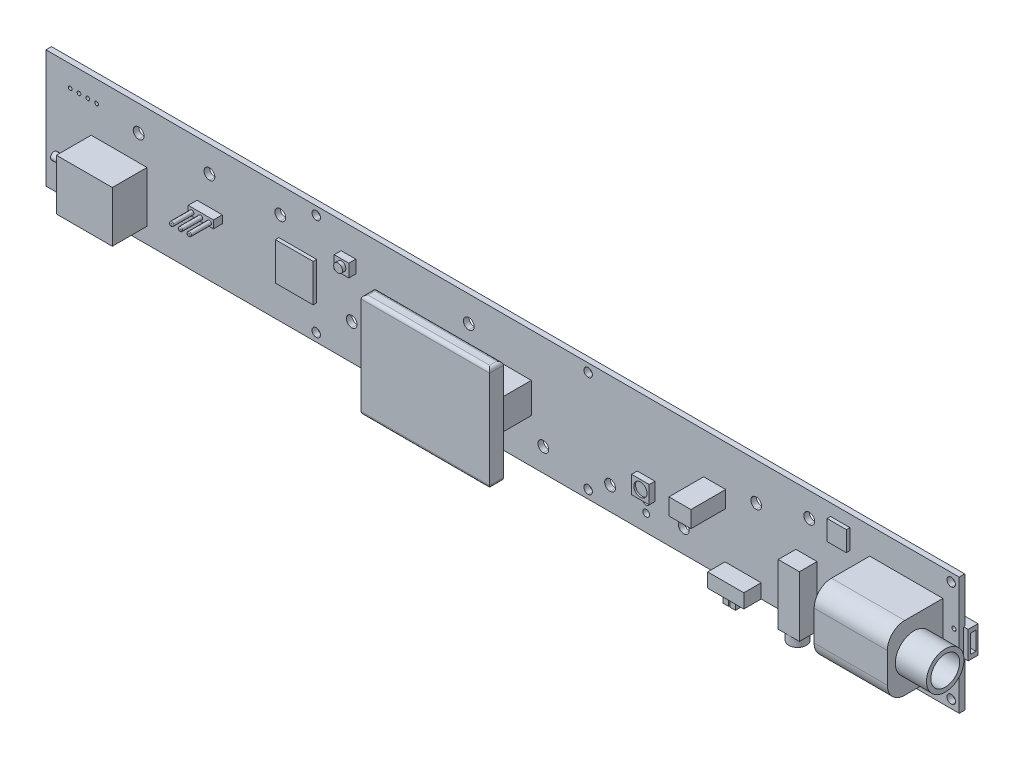
from build123d import *

# Parameters (mm, degrees)
MODEL_W                    = 263.024997078
MODEL_H                    = 33.99999939
BOSS_EXTRUDE1_DEPTH        = 1.6
SKETCH5_W                  = 16.091125075
SKETCH5_H                  = 14.669431921
BOSS_EXTRUDE5_DEPTH        = 10
SKETCH7_W                  = 10.892508314
SKETCH7_H                  = 10.848848998
BOSS_EXTRUDE7_DEPTH        = 1
SKETCH8_W                  = 4.210294841
SKETCH8_H                  = 3.712231415
BOSS_RESET_BUTTON_DEPTH    = 2
SKETCH9_R                  = 1.260457099
BOSS_EXTRUDE9_DEPTH        = 1
SKETCH10_W                 = 6.332555551
SKETCH10_H                 = 4.786515482
BOSS_EXTRUDE10_DEPTH       = 10
SKETCH11_W                 = 10.414
SKETCH11_H                 = 4.064
BOSS_EXTRUDE11_DEPTH       = 5
SKETCH12_W                 = 1.5748
SKETCH12_H                 = 1.27
BOSS_ON_OFF_BUTTON_DEPTH   = 2.54
SKETCH13_W                 = 6.096
SKETCH13_H                 = 17.399
BOSS_HEADPHONE_JACK1_DEPTH = 5.08
SKETCH14_R                 = 2.54
SKETCH14_R_2               = 1.778
BOSS_HEADPHONE_JACK2_DEPTH = 2.5
SKETCH15_W                 = 5.537872874
SKETCH15_H                 = 5.769764691
BOSS_EXTRUDE15_DEPTH       = 1
SKETCH16_W                 = 21.082
SKETCH16_H                 = 18.669
BOSS_EXTRUDE16_DEPTH       = 16
SKETCH17_R                 = 5.3975
SKETCH17_R_2               = 4.1475
BOSS_EXTRUDE17_DEPTH       = 9
BOSS_EXTRUDE18_DEPTH       = 2.54
BOSS_EXTRUDE18_DEPTH_BACK  = 0.3
SKETCH18_W                 = 5.842
SKETCH18_H                 = 7.874
SKETCH19_W                 = 1.594922006
SKETCH19_H                 = 5.279756627
CUT_EXTRUDE1_DEPTH         = 5
FILLET1_R                  = 5
SKETCH20_W                 = 6
SKETCH20_H                 = 6
BOSS_EXTRUDE19_DEPTH       = 3
SKETCH21_R                 = 2.5
BOSS_EXTRUDE20_DEPTH       = 11
SKETCH22_R                 = 1.039655937
BOSS_EXTRUDE21_DEPTH       = 3
SKETCH23_W                 = 5.08
SKETCH23_H                 = 5.08
BOSS_EXTRUDE22_DEPTH       = 1.651
BOSS_EXTRUDE23_DEPTH       = 1.905
BOSS_EXTRUDE24_DEPTH       = 1.5
BOSS_EXTRUDE24_DEPTH_BACK  = 10
SKETCH25_W                 = 11.813217451
SKETCH25_H                 = 1.460676172
BOSS_EXTRUDE25_DEPTH       = 0.5
SKETCH27_R                 = 1.905
CUT_EXTRUDE2_DEPTH         = 0.5
SKETCH28_W                 = 9.199246022
SKETCH28_H                 = 8.7957183
BOSS_EXTRUDE26_DEPTH       = 10
SKETCH29_W                 = 37
SKETCH29_H                 = 30
BOSS_EXTRUDE27_DEPTH       = 4
FILLET3_R                  = 1
SKETCH30_W                 = 8.02869844
SKETCH30_H                 = 8.621140661
BOSS_EXTRUDE28_DEPTH       = 5
SKETCH35_R                 = 0.6
BOSS_EXTRUDE29_DEPTH       = 8.54
SKETCH36_W                 = 7.262425727
SKETCH36_H                 = 2.23686425
BOSS_EXTRUDE30_DEPTH       = 2.54
FILLET5_R                  = 0.25
SKETCH38_R                 = 0.965
LED_PIN_HOLES_DEPTH        = 305.985327001
FILLET6_R                  = 0.75


with BuildPart() as part:
    # Model → Boss-Extrude1 (new body)
    with BuildSketch(Plane.XY):
        with Locations((166.116873048, 22.976248147)):
            Rectangle(MODEL_W, MODEL_H)
        with BuildLine():
            add(Edge.make_bspline(
                [(262.197098511, 34.516011578), (262.02174315, 34.516011578), (261.879598511, 34.658161062), (261.879598511, 34.833511578), (261.879598511, 35.008862094), (262.02174315, 35.151011578), (262.197098511, 35.151011578)],
                knots=[2, 2, 2, 2, 3, 3, 3, 4, 4, 4, 4], degree=3))
            add(Edge.make_bspline(
                [(262.197098511, 35.151011578), (262.372453871, 35.151011578), (262.514598511, 35.008862094), (262.514598511, 34.833511578), (262.514598511, 34.658161062), (262.372453871, 34.516011578), (262.197098511, 34.516011578)],
                knots=[0, 0, 0, 0, 1, 1, 1, 2, 2, 2, 2], degree=3))
        make_face(mode=Mode.SUBTRACT)
        with BuildLine():
            add(Edge.make_bspline(
                [(264.41164034, 33.408741202), (264.236284979, 33.408741202), (264.09414034, 33.550890686), (264.09414034, 33.726241202), (264.09414034, 33.901591717), (264.236284979, 34.043741202), (264.41164034, 34.043741202)],
                knots=[2, 2, 2, 2, 3, 3, 3, 4, 4, 4, 4], degree=3))
            add(Edge.make_bspline(
                [(264.41164034, 34.043741202), (264.5869957, 34.043741202), (264.729140339, 33.901591717), (264.729140339, 33.726241202), (264.729140339, 33.550890686), (264.5869957, 33.408741202), (264.41164034, 33.408741202)],
                knots=[0, 0, 0, 0, 1, 1, 1, 2, 2, 2, 2], degree=3))
        make_face(mode=Mode.SUBTRACT)
        with BuildLine():
            add(Edge.make_bspline(
                [(295.319366162, 36.366260398), (294.645591612, 36.366260398), (294.099371723, 36.912468713), (294.099371723, 37.586250799), (294.099371723, 38.260032885), (294.645591612, 38.806241201), (295.319366162, 38.806241201)],
                knots=[2, 2, 2, 2, 3, 3, 3, 4, 4, 4, 4], degree=3))
            add(Edge.make_bspline(
                [(295.319366162, 38.806241201), (295.993140711, 38.806241201), (296.539360601, 38.260032885), (296.539360601, 37.586250799), (296.539360601, 36.912468713), (295.993140711, 36.366260398), (295.319366162, 36.366260398)],
                knots=[0, 0, 0, 0, 1, 1, 1, 2, 2, 2, 2], degree=3))
        make_face(mode=Mode.SUBTRACT)
        with BuildLine():
            add(Edge.make_bspline(
                [(264.41164034, 32.301469749), (264.236284979, 32.301469749), (264.09414034, 32.443619772), (264.09414034, 32.618970287), (264.09414034, 32.794320803), (264.236284979, 32.936470287), (264.41164034, 32.936470287)],
                knots=[2, 2, 2, 2, 3, 3, 3, 4, 4, 4, 4], degree=3))
            add(Edge.make_bspline(
                [(264.41164034, 32.936470287), (264.5869957, 32.936470287), (264.729140339, 32.794320803), (264.729140339, 32.618970287), (264.729140339, 32.443619772), (264.5869957, 32.301469749), (264.41164034, 32.301469749)],
                knots=[0, 0, 0, 0, 1, 1, 1, 2, 2, 2, 2], degree=3))
        make_face(mode=Mode.SUBTRACT)
        with BuildLine():
            add(Edge.make_bspline(
                [(262.197098511, 33.408741202), (262.02174315, 33.408741202), (261.879598511, 33.550890686), (261.879598511, 33.726241202), (261.879598511, 33.901591717), (262.02174315, 34.043741202), (262.197098511, 34.043741202)],
                knots=[2, 2, 2, 2, 3, 3, 3, 4, 4, 4, 4], degree=3))
            add(Edge.make_bspline(
                [(262.197098511, 34.043741202), (262.372453871, 34.043741202), (262.514598511, 33.901591717), (262.514598511, 33.726241202), (262.514598511, 33.550890686), (262.372453871, 33.408741202), (262.197098511, 33.408741202)],
                knots=[0, 0, 0, 0, 1, 1, 1, 2, 2, 2, 2], degree=3))
        make_face(mode=Mode.SUBTRACT)
        with BuildLine():
            add(Edge.make_bspline(
                [(112.43937482, 36.376251175), (111.765591658, 36.376251175), (111.219380382, 36.92245949), (111.219380382, 37.596241576), (111.219380382, 38.270023662), (111.765591658, 38.816231978), (112.43937482, 38.816231978)],
                knots=[2, 2, 2, 2, 3, 3, 3, 4, 4, 4, 4], degree=3))
            add(Edge.make_bspline(
                [(112.43937482, 38.816231978), (113.113157983, 38.816231978), (113.659369259, 38.270023662), (113.659369259, 37.596241576), (113.659369259, 36.92245949), (113.113157983, 36.376251175), (112.43937482, 36.376251175)],
                knots=[0, 0, 0, 0, 1, 1, 1, 2, 2, 2, 2], degree=3))
        make_face(mode=Mode.SUBTRACT)
        with BuildLine():
            add(Edge.make_bspline(
                [(190.759374597, 7.156260405), (190.085600048, 7.156260405), (189.539380159, 7.702469528), (189.539380159, 8.376250537), (189.539380159, 9.050031546), (190.085600048, 9.59624067), (190.759374597, 9.59624067)],
                knots=[2, 2, 2, 2, 3, 3, 3, 4, 4, 4, 4], degree=3))
            add(Edge.make_bspline(
                [(190.759374597, 9.59624067), (191.433149147, 9.59624067), (191.979369036, 9.050031546), (191.979369036, 8.376250537), (191.979369036, 7.702469528), (191.433149147, 7.156260405), (190.759374597, 7.156260405)],
                knots=[0, 0, 0, 0, 1, 1, 1, 2, 2, 2, 2], degree=3))
        make_face(mode=Mode.SUBTRACT)
        with BuildLine():
            add(Edge.make_bspline(
                [(190.759374597, 36.366260398), (190.085600048, 36.366260398), (189.539380159, 36.912468713), (189.539380159, 37.586250799), (189.539380159, 38.260032885), (190.085600048, 38.806241201), (190.759374597, 38.806241201)],
                knots=[2, 2, 2, 2, 3, 3, 3, 4, 4, 4, 4], degree=3))
            add(Edge.make_bspline(
                [(190.759374597, 38.806241201), (191.433149147, 38.806241201), (191.979369036, 38.260032885), (191.979369036, 37.586250799), (191.979369036, 36.912468713), (191.433149147, 36.366260398), (190.759374597, 36.366260398)],
                knots=[0, 0, 0, 0, 1, 1, 1, 2, 2, 2, 2], degree=3))
        make_face(mode=Mode.SUBTRACT)
        with BuildLine():
            add(Edge.make_bspline(
                [(263.304369425, 33.408741202), (263.129014065, 33.408741202), (262.986869425, 33.550890686), (262.986869425, 33.726241202), (262.986869425, 33.901591717), (263.129014065, 34.043741202), (263.304369425, 34.043741202)],
                knots=[2, 2, 2, 2, 3, 3, 3, 4, 4, 4, 4], degree=3))
            add(Edge.make_bspline(
                [(263.304369425, 34.043741202), (263.479724785, 34.043741202), (263.621869425, 33.901591717), (263.621869425, 33.726241202), (263.621869425, 33.550890686), (263.479724785, 33.408741202), (263.304369425, 33.408741202)],
                knots=[0, 0, 0, 0, 1, 1, 1, 2, 2, 2, 2], degree=3))
        make_face(mode=Mode.SUBTRACT)
        with BuildLine():
            add(Edge.make_bspline(
                [(263.304369425, 34.516011578), (263.129014065, 34.516011578), (262.986869425, 34.658161062), (262.986869425, 34.833511578), (262.986869425, 35.008862094), (263.129014065, 35.151011578), (263.304369425, 35.151011578)],
                knots=[2, 2, 2, 2, 3, 3, 3, 4, 4, 4, 4], degree=3))
            add(Edge.make_bspline(
                [(263.304369425, 35.151011578), (263.479724785, 35.151011578), (263.621869425, 35.008862094), (263.621869425, 34.833511578), (263.621869425, 34.658161062), (263.479724785, 34.516011578), (263.304369425, 34.516011578)],
                knots=[0, 0, 0, 0, 1, 1, 1, 2, 2, 2, 2], degree=3))
        make_face(mode=Mode.SUBTRACT)
        with BuildLine():
            add(Edge.make_bspline(
                [(262.197098511, 32.301469749), (262.02174315, 32.301469749), (261.879598511, 32.443619772), (261.879598511, 32.618970287), (261.879598511, 32.794320803), (262.02174315, 32.936470287), (262.197098511, 32.936470287)],
                knots=[2, 2, 2, 2, 3, 3, 3, 4, 4, 4, 4], degree=3))
            add(Edge.make_bspline(
                [(262.197098511, 32.936470287), (262.372453871, 32.936470287), (262.514598511, 32.794320803), (262.514598511, 32.618970287), (262.514598511, 32.443619772), (262.372453871, 32.301469749), (262.197098511, 32.301469749)],
                knots=[0, 0, 0, 0, 1, 1, 1, 2, 2, 2, 2], degree=3))
        make_face(mode=Mode.SUBTRACT)
        with BuildLine():
            add(Edge.make_bspline(
                [(263.304369425, 32.301469749), (263.129014065, 32.301469749), (262.986869425, 32.443619772), (262.986869425, 32.618970287), (262.986869425, 32.794320803), (263.129014065, 32.936470287), (263.304369425, 32.936470287)],
                knots=[2, 2, 2, 2, 3, 3, 3, 4, 4, 4, 4], degree=3))
            add(Edge.make_bspline(
                [(263.304369425, 32.936470287), (263.479724785, 32.936470287), (263.621869425, 32.794320803), (263.621869425, 32.618970287), (263.621869425, 32.443619772), (263.479724785, 32.301469749), (263.304369425, 32.301469749)],
                knots=[0, 0, 0, 0, 1, 1, 1, 2, 2, 2, 2], degree=3))
        make_face(mode=Mode.SUBTRACT)
        with BuildLine():
            add(Edge.make_bspline(
                [(264.41164034, 34.516011578), (264.236284979, 34.516011578), (264.09414034, 34.658161062), (264.09414034, 34.833511578), (264.09414034, 35.008862094), (264.236284979, 35.151011578), (264.41164034, 35.151011578)],
                knots=[2, 2, 2, 2, 3, 3, 3, 4, 4, 4, 4], degree=3))
            add(Edge.make_bspline(
                [(264.41164034, 35.151011578), (264.5869957, 35.151011578), (264.729140339, 35.008862094), (264.729140339, 34.833511578), (264.729140339, 34.658161062), (264.5869957, 34.516011578), (264.41164034, 34.516011578)],
                knots=[0, 0, 0, 0, 1, 1, 1, 2, 2, 2, 2], degree=3))
        make_face(mode=Mode.SUBTRACT)
        with BuildLine():
            add(Edge.make_bspline(
                [(295.319366162, 7.156260405), (294.645591612, 7.156260405), (294.099371723, 7.702469528), (294.099371723, 8.376250537), (294.099371723, 9.050031546), (294.645591612, 9.59624067), (295.319366162, 9.59624067)],
                knots=[2, 2, 2, 2, 3, 3, 3, 4, 4, 4, 4], degree=3))
            add(Edge.make_bspline(
                [(295.319366162, 9.59624067), (295.993140711, 9.59624067), (296.539360601, 9.050031546), (296.539360601, 8.376250537), (296.539360601, 7.702469528), (295.993140711, 7.156260405), (295.319366162, 7.156260405)],
                knots=[0, 0, 0, 0, 1, 1, 1, 2, 2, 2, 2], degree=3))
        make_face(mode=Mode.SUBTRACT)
        with BuildLine():
            add(Edge.make_bspline(
                [(112.43937482, 7.156260405), (111.765591658, 7.156260405), (111.219380382, 7.702469528), (111.219380382, 8.376250537), (111.219380382, 9.050031546), (111.765591658, 9.59624067), (112.43937482, 9.59624067)],
                knots=[2, 2, 2, 2, 3, 3, 3, 4, 4, 4, 4], degree=3))
            add(Edge.make_bspline(
                [(112.43937482, 9.59624067), (113.113157983, 9.59624067), (113.659369259, 9.050031546), (113.659369259, 8.376250537), (113.659369259, 7.702469528), (113.113157983, 7.156260405), (112.43937482, 7.156260405)],
                knots=[0, 0, 0, 0, 1, 1, 1, 2, 2, 2, 2], degree=3))
        make_face(mode=Mode.SUBTRACT)
        with BuildLine():
            add(Edge.make_bspline(
                [(197.069377037, 11.086261692), (196.213339711, 11.086261692), (195.519376902, 11.780215889), (195.519376902, 12.636253215), (195.519376902, 13.492290541), (196.213339711, 14.186244737), (197.069377037, 14.186244737)],
                knots=[2, 2, 2, 2, 3, 3, 3, 4, 4, 4, 4], degree=3))
            add(Edge.make_bspline(
                [(197.069377037, 14.186244737), (197.925414363, 14.186244737), (198.619377172, 13.492290541), (198.619377172, 12.636253215), (198.619377172, 11.780215889), (197.925414363, 11.086261692), (197.069377037, 11.086261692)],
                knots=[0, 0, 0, 0, 1, 1, 1, 2, 2, 2, 2], degree=3))
        make_face(mode=Mode.SUBTRACT)
        with BuildLine():
            add(Edge.make_bspline(
                [(122.649380379, 14.666249891), (121.793343053, 14.666249891), (121.099388856, 15.360206241), (121.099388856, 16.216243567), (121.099388856, 17.072280893), (121.793343053, 17.766237243), (122.649380379, 17.766237243)],
                knots=[2, 2, 2, 2, 3, 3, 3, 4, 4, 4, 4], degree=3))
            add(Edge.make_bspline(
                [(122.649380379, 17.766237243), (123.505417705, 17.766237243), (124.199371901, 17.072280893), (124.199371901, 16.216243567), (124.199371901, 15.360206241), (123.505417705, 14.666249891), (122.649380379, 14.666249891)],
                knots=[0, 0, 0, 0, 1, 1, 1, 2, 2, 2, 2], degree=3))
        make_face(mode=Mode.SUBTRACT)
        with BuildLine():
            add(Edge.make_bspline(
                [(81.679378999, 30.996249031), (80.823341673, 30.996249031), (80.129387476, 31.690204304), (80.129387476, 32.54624163), (80.129387476, 33.402278956), (80.823341673, 34.096234229), (81.679378999, 34.096234229)],
                knots=[2, 2, 2, 2, 3, 3, 3, 4, 4, 4, 4], degree=3))
            add(Edge.make_bspline(
                [(81.679378999, 34.096234229), (82.535416325, 34.096234229), (83.229370521, 33.402278956), (83.229370521, 32.54624163), (83.229370521, 31.690204304), (82.535416325, 30.996249031), (81.679378999, 30.996249031)],
                knots=[0, 0, 0, 0, 1, 1, 1, 2, 2, 2, 2], degree=3))
        make_face(mode=Mode.SUBTRACT)
        with BuildLine():
            add(Edge.make_bspline(
                [(156.379362874, 30.996249031), (155.523325547, 30.996249031), (154.829371351, 31.690204304), (154.829371351, 32.54624163), (154.829371351, 33.402278956), (155.523325547, 34.096234229), (156.379362874, 34.096234229)],
                knots=[2, 2, 2, 2, 3, 3, 3, 4, 4, 4, 4], degree=3))
            add(Edge.make_bspline(
                [(156.379362874, 34.096234229), (157.2354002, 34.096234229), (157.929354396, 33.402278956), (157.929354396, 32.54624163), (157.929354396, 31.690204304), (157.2354002, 30.996249031), (156.379362874, 30.996249031)],
                knots=[0, 0, 0, 0, 1, 1, 1, 2, 2, 2, 2], degree=3))
        make_face(mode=Mode.SUBTRACT)
        with BuildLine():
            add(Edge.make_bspline(
                [(254.419364816, 31.456243563), (253.56332749, 31.456243563), (252.869364681, 32.150198836), (252.869364681, 33.006235624), (252.869364681, 33.86227295), (253.56332749, 34.556228223), (254.419364816, 34.556228223)],
                knots=[2, 2, 2, 2, 3, 3, 3, 4, 4, 4, 4], degree=3))
            add(Edge.make_bspline(
                [(254.419364816, 34.556228223), (255.275402142, 34.556228223), (255.969364951, 33.86227295), (255.969364951, 33.006235624), (255.969364951, 32.150198836), (255.275402142, 31.456243563), (254.419364816, 31.456243563)],
                knots=[0, 0, 0, 0, 1, 1, 1, 2, 2, 2, 2], degree=3))
        make_face(mode=Mode.SUBTRACT)
        with BuildLine():
            add(Edge.make_bspline(
                [(137.839374814, 11.086261692), (136.983337488, 11.086261692), (136.289383292, 11.780215889), (136.289383292, 12.636253215), (136.289383292, 13.492290541), (136.983337488, 14.186244737), (137.839374814, 14.186244737)],
                knots=[2, 2, 2, 2, 3, 3, 3, 4, 4, 4, 4], degree=3))
            add(Edge.make_bspline(
                [(137.839374814, 14.186244737), (138.69541214, 14.186244737), (139.389366337, 13.492290541), (139.389366337, 12.636253215), (139.389366337, 11.780215889), (138.69541214, 11.086261692), (137.839374814, 11.086261692)],
                knots=[0, 0, 0, 0, 1, 1, 1, 2, 2, 2, 2], degree=3))
        make_face(mode=Mode.SUBTRACT)
        with BuildLine():
            add(Edge.make_bspline(
                [(253.62936997, 8.814033893), (253.1875537, 8.814033893), (252.829384347, 9.172201092), (252.829384347, 9.614021669), (252.829384347, 10.055842246), (253.1875537, 10.414009444), (253.62936997, 10.414009444)],
                knots=[2, 2, 2, 2, 3, 3, 3, 4, 4, 4, 4], degree=3))
            add(Edge.make_bspline(
                [(253.62936997, 10.414009444), (254.071186241, 10.414009444), (254.429355593, 10.055842246), (254.429355593, 9.614021669), (254.429355593, 9.172201092), (254.071186241, 8.814033893), (253.62936997, 8.814033893)],
                knots=[0, 0, 0, 0, 1, 1, 1, 2, 2, 2, 2], degree=3))
        make_face(mode=Mode.SUBTRACT)
        with BuildLine():
            add(Edge.make_bspline(
                [(253.62936997, 15.814020056), (253.1875537, 15.814020056), (252.829384347, 16.172187255), (252.829384347, 16.614007832), (252.829384347, 17.055828409), (253.1875537, 17.413995608), (253.62936997, 17.413995608)],
                knots=[2, 2, 2, 2, 3, 3, 3, 4, 4, 4, 4], degree=3))
            add(Edge.make_bspline(
                [(253.62936997, 17.413995608), (254.071186241, 17.413995608), (254.429355593, 17.055828409), (254.429355593, 16.614007832), (254.429355593, 16.172187255), (254.071186241, 15.814020056), (253.62936997, 15.814020056)],
                knots=[0, 0, 0, 0, 1, 1, 1, 2, 2, 2, 2], degree=3))
        make_face(mode=Mode.SUBTRACT)
        with BuildLine():
            add(Edge.make_bspline(
                [(218.299381779, 11.086261692), (217.443344453, 11.086261692), (216.749381644, 11.780215889), (216.749381644, 12.636253215), (216.749381644, 13.492290541), (217.443344453, 14.186244737), (218.299381779, 14.186244737)],
                knots=[2, 2, 2, 2, 3, 3, 3, 4, 4, 4, 4], degree=3))
            add(Edge.make_bspline(
                [(218.299381779, 14.186244737), (219.155419105, 14.186244737), (219.849381914, 13.492290541), (219.849381914, 12.636253215), (219.849381914, 11.780215889), (219.155419105, 11.086261692), (218.299381779, 11.086261692)],
                knots=[0, 0, 0, 0, 1, 1, 1, 2, 2, 2, 2], degree=3))
        make_face(mode=Mode.SUBTRACT)
        with BuildLine():
            add(Edge.make_bspline(
                [(237.37937133, 7.501250114), (237.103229702, 7.501250114), (236.879350172, 7.725112418), (236.879350172, 8.00126266), (236.879350172, 8.277412901), (237.103229702, 8.501275206), (237.37937133, 8.501275206)],
                knots=[2, 2, 2, 2, 3, 3, 3, 4, 4, 4, 4], degree=3))
            add(Edge.make_bspline(
                [(237.37937133, 8.501275206), (237.655512959, 8.501275206), (237.879392489, 8.277412901), (237.879392489, 8.00126266), (237.879392489, 7.725112418), (237.655512959, 7.501250114), (237.37937133, 7.501250114)],
                knots=[0, 0, 0, 0, 1, 1, 1, 2, 2, 2, 2], degree=3))
        make_face(mode=Mode.SUBTRACT)
        with BuildLine():
            add(Edge.make_bspline(
                [(235.379372823, 7.501250114), (235.103231194, 7.501250114), (234.879351664, 7.725112418), (234.879351664, 8.00126266), (234.879351664, 8.277412901), (235.103231194, 8.501275206), (235.379372823, 8.501275206)],
                knots=[2, 2, 2, 2, 3, 3, 3, 4, 4, 4, 4], degree=3))
            add(Edge.make_bspline(
                [(235.379372823, 8.501275206), (235.655514452, 8.501275206), (235.879393982, 8.277412901), (235.879393982, 8.00126266), (235.879393982, 7.725112418), (235.655514452, 7.501250114), (235.379372823, 7.501250114)],
                knots=[0, 0, 0, 0, 1, 1, 1, 2, 2, 2, 2], degree=3))
        make_face(mode=Mode.SUBTRACT)
        with BuildLine():
            add(Edge.make_bspline(
                [(233.379374315, 7.501250114), (233.103232687, 7.501250114), (232.879353157, 7.725112418), (232.879353157, 8.00126266), (232.879353157, 8.277412901), (233.103232687, 8.501275206), (233.379374315, 8.501275206)],
                knots=[2, 2, 2, 2, 3, 3, 3, 4, 4, 4, 4], degree=3))
            add(Edge.make_bspline(
                [(233.379374315, 8.501275206), (233.655515944, 8.501275206), (233.879395474, 8.277412901), (233.879395474, 8.00126266), (233.879395474, 7.725112418), (233.655515944, 7.501250114), (233.379374315, 7.501250114)],
                knots=[0, 0, 0, 0, 1, 1, 1, 2, 2, 2, 2], degree=3))
        make_face(mode=Mode.SUBTRACT)
        with BuildLine():
            add(Edge.make_bspline(
                [(239.159383266, 27.62626201), (238.30334594, 27.62626201), (237.609383131, 28.320217283), (237.609383131, 29.17625461), (237.609383131, 30.032291936), (238.30334594, 30.726247209), (239.159383266, 30.726247209)],
                knots=[2, 2, 2, 2, 3, 3, 3, 4, 4, 4, 4], degree=3))
            add(Edge.make_bspline(
                [(239.159383266, 30.726247209), (240.015420592, 30.726247209), (240.709383401, 30.032291936), (240.709383401, 29.17625461), (240.709383401, 28.320217283), (240.015420592, 27.62626201), (239.159383266, 27.62626201)],
                knots=[0, 0, 0, 0, 1, 1, 1, 2, 2, 2, 2], degree=3))
        make_face(mode=Mode.SUBTRACT)
        with BuildLine():
            add(Edge.make_bspline(
                [(177.839370803, 11.086261692), (176.983333477, 11.086261692), (176.28937928, 11.780215889), (176.28937928, 12.636253215), (176.28937928, 13.492290541), (176.983333477, 14.186244737), (177.839370803, 14.186244737)],
                knots=[2, 2, 2, 2, 3, 3, 3, 4, 4, 4, 4], degree=3))
            add(Edge.make_bspline(
                [(177.839370803, 14.186244737), (178.695408129, 14.186244737), (179.389370938, 13.492290541), (179.389370938, 12.636253215), (179.389370938, 11.780215889), (178.695408129, 11.086261692), (177.839370803, 11.086261692)],
                knots=[0, 0, 0, 0, 1, 1, 1, 2, 2, 2, 2], degree=3))
        make_face(mode=Mode.SUBTRACT)
        with BuildLine():
            add(Edge.make_bspline(
                [(288.931694044, 30.16626201), (288.39322562, 30.16626201), (287.956697571, 30.602781446), (287.956697571, 31.141255253), (287.956697571, 31.679729061), (288.39322562, 32.116248497), (288.931694044, 32.116248497)],
                knots=[2, 2, 2, 2, 3, 3, 3, 4, 4, 4, 4], degree=3))
            add(Edge.make_bspline(
                [(288.931694044, 32.116248497), (289.470162469, 32.116248497), (289.906690518, 31.679729061), (289.906690518, 31.141255253), (289.906690518, 30.602781446), (289.470162469, 30.16626201), (288.931694044, 30.16626201)],
                knots=[0, 0, 0, 0, 1, 1, 1, 2, 2, 2, 2], degree=3))
        make_face(mode=Mode.SUBTRACT)
        with BuildLine():
            add(Edge.make_bspline(
                [(282.581694046, 30.16626201), (282.043225622, 30.16626201), (281.606697573, 30.602781446), (281.606697573, 31.141255253), (281.606697573, 31.679729061), (282.043225622, 32.116248497), (282.581694046, 32.116248497)],
                knots=[2, 2, 2, 2, 3, 3, 3, 4, 4, 4, 4], degree=3))
            add(Edge.make_bspline(
                [(282.581694046, 32.116248497), (283.12016247, 32.116248497), (283.556690519, 31.679729061), (283.556690519, 31.141255253), (283.556690519, 30.602781446), (283.12016247, 30.16626201), (282.581694046, 30.16626201)],
                knots=[0, 0, 0, 0, 1, 1, 1, 2, 2, 2, 2], degree=3))
        make_face(mode=Mode.SUBTRACT)
        with BuildLine():
            add(Edge.make_bspline(
                [(276.231694048, 30.16626201), (275.693225623, 30.16626201), (275.256697574, 30.602781446), (275.256697574, 31.141255253), (275.256697574, 31.679729061), (275.693225623, 32.116248497), (276.231694048, 32.116248497)],
                knots=[2, 2, 2, 2, 3, 3, 3, 4, 4, 4, 4], degree=3))
            add(Edge.make_bspline(
                [(276.231694048, 32.116248497), (276.770162472, 32.116248497), (277.206690521, 31.679729061), (277.206690521, 31.141255253), (277.206690521, 30.602781446), (276.770162472, 30.16626201), (276.231694048, 30.16626201)],
                knots=[0, 0, 0, 0, 1, 1, 1, 2, 2, 2, 2], degree=3))
        make_face(mode=Mode.SUBTRACT)
        with BuildLine():
            add(Edge.make_bspline(
                [(276.231694048, 13.93625569), (275.693225623, 13.93625569), (275.256697574, 14.372772973), (275.256697574, 14.911247857), (275.256697574, 15.449722741), (275.693225623, 15.886240024), (276.231694048, 15.886240024)],
                knots=[2, 2, 2, 2, 3, 3, 3, 4, 4, 4, 4], degree=3))
            add(Edge.make_bspline(
                [(276.231694048, 15.886240024), (276.770162472, 15.886240024), (277.206690521, 15.449722741), (277.206690521, 14.911247857), (277.206690521, 14.372772973), (276.770162472, 13.93625569), (276.231694048, 13.93625569)],
                knots=[0, 0, 0, 0, 1, 1, 1, 2, 2, 2, 2], degree=3))
        make_face(mode=Mode.SUBTRACT)
        with BuildLine():
            add(Edge.make_bspline(
                [(282.581694046, 13.93625569), (282.043225622, 13.93625569), (281.606697573, 14.372772973), (281.606697573, 14.911247857), (281.606697573, 15.449722741), (282.043225622, 15.886240024), (282.581694046, 15.886240024)],
                knots=[2, 2, 2, 2, 3, 3, 3, 4, 4, 4, 4], degree=3))
            add(Edge.make_bspline(
                [(282.581694046, 15.886240024), (283.12016247, 15.886240024), (283.556690519, 15.449722741), (283.556690519, 14.911247857), (283.556690519, 14.372772973), (283.12016247, 13.93625569), (282.581694046, 13.93625569)],
                knots=[0, 0, 0, 0, 1, 1, 1, 2, 2, 2, 2], degree=3))
        make_face(mode=Mode.SUBTRACT)
        with BuildLine():
            add(Edge.make_bspline(
                [(288.931694044, 13.93625569), (288.39322562, 13.93625569), (287.956697571, 14.372772973), (287.956697571, 14.911247857), (287.956697571, 15.449722741), (288.39322562, 15.886240024), (288.931694044, 15.886240024)],
                knots=[2, 2, 2, 2, 3, 3, 3, 4, 4, 4, 4], degree=3))
            add(Edge.make_bspline(
                [(288.931694044, 15.886240024), (289.470162469, 15.886240024), (289.906690518, 15.449722741), (289.906690518, 14.911247857), (289.906690518, 14.372772973), (289.470162469, 13.93625569), (288.931694044, 13.93625569)],
                knots=[0, 0, 0, 0, 1, 1, 1, 2, 2, 2, 2], degree=3))
        make_face(mode=Mode.SUBTRACT)
        with BuildLine():
            add(Edge.make_bspline(
                [(61.279368814, 30.996249031), (60.423331488, 30.996249031), (59.729375139, 31.690204304), (59.729375139, 32.54624163), (59.729375139, 33.402278956), (60.423331488, 34.096234229), (61.279368814, 34.096234229)],
                knots=[2, 2, 2, 2, 3, 3, 3, 4, 4, 4, 4], degree=3))
            add(Edge.make_bspline(
                [(61.279368814, 34.096234229), (62.135406141, 34.096234229), (62.82936249, 33.402278956), (62.82936249, 32.54624163), (62.82936249, 31.690204304), (62.135406141, 30.996249031), (61.279368814, 30.996249031)],
                knots=[0, 0, 0, 0, 1, 1, 1, 2, 2, 2, 2], degree=3))
        make_face(mode=Mode.SUBTRACT)
        with BuildLine():
            add(Edge.make_bspline(
                [(41.569362809, 33.326247852), (41.265609278, 33.326247852), (41.019368387, 33.572488744), (41.019368387, 33.876242274), (41.019368387, 34.179995805), (41.265609278, 34.426236696), (41.569362809, 34.426236696)],
                knots=[2, 2, 2, 2, 3, 3, 3, 4, 4, 4, 4], degree=3))
            add(Edge.make_bspline(
                [(41.569362809, 34.426236696), (41.87311634, 34.426236696), (42.119357231, 34.179995805), (42.119357231, 33.876242274), (42.119357231, 33.572488744), (41.87311634, 33.326247852), (41.569362809, 33.326247852)],
                knots=[0, 0, 0, 0, 1, 1, 1, 2, 2, 2, 2], degree=3))
        make_face(mode=Mode.SUBTRACT)
        with BuildLine():
            add(Edge.make_bspline(
                [(44.109362808, 33.326247852), (43.805608739, 33.326247852), (43.559368387, 33.572488744), (43.559368387, 33.876242274), (43.559368387, 34.179995805), (43.805608739, 34.426236696), (44.109362808, 34.426236696)],
                knots=[2, 2, 2, 2, 3, 3, 3, 4, 4, 4, 4], degree=3))
            add(Edge.make_bspline(
                [(44.109362808, 34.426236696), (44.413116877, 34.426236696), (44.65935723, 34.179995805), (44.65935723, 33.876242274), (44.65935723, 33.572488744), (44.413116877, 33.326247852), (44.109362808, 33.326247852)],
                knots=[0, 0, 0, 0, 1, 1, 1, 2, 2, 2, 2], degree=3))
        make_face(mode=Mode.SUBTRACT)
        with BuildLine():
            add(Edge.make_bspline(
                [(46.649362808, 33.326247852), (46.345608739, 33.326247852), (46.099368386, 33.572488744), (46.099368386, 33.876242274), (46.099368386, 34.179995805), (46.345608739, 34.426236696), (46.649362808, 34.426236696)],
                knots=[2, 2, 2, 2, 3, 3, 3, 4, 4, 4, 4], degree=3))
            add(Edge.make_bspline(
                [(46.649362808, 34.426236696), (46.953116877, 34.426236696), (47.19935723, 34.179995805), (47.19935723, 33.876242274), (47.19935723, 33.572488744), (46.953116877, 33.326247852), (46.649362808, 33.326247852)],
                knots=[0, 0, 0, 0, 1, 1, 1, 2, 2, 2, 2], degree=3))
        make_face(mode=Mode.SUBTRACT)
        with BuildLine():
            add(Edge.make_bspline(
                [(49.189362807, 33.326247852), (48.885608738, 33.326247852), (48.639368385, 33.572488744), (48.639368385, 33.876242274), (48.639368385, 34.179995805), (48.885608738, 34.426236696), (49.189362807, 34.426236696)],
                knots=[2, 2, 2, 2, 3, 3, 3, 4, 4, 4, 4], degree=3))
            add(Edge.make_bspline(
                [(49.189362807, 34.426236696), (49.493116876, 34.426236696), (49.739357229, 34.179995805), (49.739357229, 33.876242274), (49.739357229, 33.572488744), (49.493116876, 33.326247852), (49.189362807, 33.326247852)],
                knots=[0, 0, 0, 0, 1, 1, 1, 2, 2, 2, 2], degree=3))
        make_face(mode=Mode.SUBTRACT)
        with BuildLine():
            add(Edge.make_bspline(
                [(296.129377012, 19.151240989), (295.798010503, 19.151240989), (295.529379183, 19.41987231), (295.529379183, 19.751245279), (295.529379183, 20.082618247), (295.798010503, 20.351249568), (296.129377012, 20.351249568)],
                knots=[2, 2, 2, 2, 3, 3, 3, 4, 4, 4, 4], degree=3))
            add(Edge.make_bspline(
                [(296.129377012, 20.351249568), (296.460743522, 20.351249568), (296.729374842, 20.082618247), (296.729374842, 19.751245279), (296.729374842, 19.41987231), (296.460743522, 19.151240989), (296.129377012, 19.151240989)],
                knots=[0, 0, 0, 0, 1, 1, 1, 2, 2, 2, 2], degree=3))
        make_face(mode=Mode.SUBTRACT)
        with BuildLine():
            add(Edge.make_bspline(
                [(296.129377012, 25.751234342), (295.798010503, 25.751234342), (295.529379183, 26.019865662), (295.529379183, 26.351238631), (295.529379183, 26.6826116), (295.798010503, 26.95124292), (296.129377012, 26.95124292)],
                knots=[2, 2, 2, 2, 3, 3, 3, 4, 4, 4, 4], degree=3))
            add(Edge.make_bspline(
                [(296.129377012, 26.95124292), (296.460743522, 26.95124292), (296.729374842, 26.6826116), (296.729374842, 26.351238631), (296.729374842, 26.019865662), (296.460743522, 25.751234342), (296.129377012, 25.751234342)],
                knots=[0, 0, 0, 0, 1, 1, 1, 2, 2, 2, 2], degree=3))
        make_face(mode=Mode.SUBTRACT)
        with BuildLine():
            add(Edge.make_bspline(
                [(102.069370415, 30.996249031), (101.213333089, 30.996249031), (100.519378892, 31.690204304), (100.519378892, 32.54624163), (100.519378892, 33.402278956), (101.213333089, 34.096234229), (102.069370415, 34.096234229)],
                knots=[2, 2, 2, 2, 3, 3, 3, 4, 4, 4, 4], degree=3))
            add(Edge.make_bspline(
                [(102.069370415, 34.096234229), (102.925407741, 34.096234229), (103.619361937, 33.402278956), (103.619361937, 32.54624163), (103.619361937, 31.690204304), (102.925407741, 30.996249031), (102.069370415, 30.996249031)],
                knots=[0, 0, 0, 0, 1, 1, 1, 2, 2, 2, 2], degree=3))
        make_face(mode=Mode.SUBTRACT)
    extrude(amount=BOSS_EXTRUDE1_DEPTH)

    # Sketch5 → Boss-Extrude5 (add)
    with BuildSketch(Plane.XY.offset(1.6)):
        with Locations((55.653886505, 17.850465048)):
            Rectangle(SKETCH5_W, SKETCH5_H)
    extrude(amount=BOSS_EXTRUDE5_DEPTH)

    # Sketch7 → Boss-Extrude7 (add)
    with BuildSketch(Plane.XY.offset(1.6)):
        with Locations((107.114098776, 21.250367342)):
            Rectangle(SKETCH7_W, SKETCH7_H)
    extrude(amount=BOSS_EXTRUDE7_DEPTH)

    # Sketch8 → Boss-Reset Button (add)
    with BuildSketch(Plane.XY.offset(1.6)):
        with Locations((121.717023127, 30.525533581)):
            Rectangle(SKETCH8_W, SKETCH8_H)
    extrude(amount=BOSS_RESET_BUTTON_DEPTH)

    # Sketch9 → Boss-Extrude9 (add)
    with BuildSketch(Plane.XY.offset(3.6)):
        with Locations((121.711736888, 30.600754967)):
            Circle(SKETCH9_R)
    extrude(amount=BOSS_EXTRUDE9_DEPTH)

    # Sketch10 → Boss-Extrude10 (add)
    with BuildSketch(Plane.XY.offset(1.6)):
        with Locations((227.191974267, 25.795608812)):
            Rectangle(SKETCH10_W, SKETCH10_H)
    extrude(amount=BOSS_EXTRUDE10_DEPTH)

    # Sketch11 → Boss-Extrude11 (add)
    with BuildSketch(Plane.XY.offset(1.6)):
        with Locations((235.379372823, 8.008248452)):
            Rectangle(SKETCH11_W, SKETCH11_H)
    extrude(amount=BOSS_EXTRUDE11_DEPTH)

    # Sketch12 → Boss-on off button (add)
    with BuildSketch(Plane(origin=(0, 5.976248452, 0), x_dir=(-1, 0, 0), z_dir=(0, -1, 0))):
        with Locations((-236.369972823, -4.965)):
            Rectangle(SKETCH12_W, SKETCH12_H)
        with Locations((-234.388772823, -4.965)):
            Rectangle(SKETCH12_W, SKETCH12_H)
    extrude(amount=BOSS_ON_OFF_BUTTON_DEPTH)

    # Sketch13 → Boss-headphone jack1 (add)
    with BuildSketch(Plane.XY.offset(1.6)):
        with Locations((253.62936997, 14.675748452)):
            Rectangle(SKETCH13_W, SKETCH13_H)
    extrude(amount=BOSS_HEADPHONE_JACK1_DEPTH)

    # Sketch14 → Boss-headphone jack2 (add)
    with BuildSketch(Plane(origin=(0, 5.976248452, 0), x_dir=(-1, 0, 0), z_dir=(0, -1, 0))):
        with Locations((-253.62936997, -4.14)):
            Circle(SKETCH14_R)
        with Locations((-253.62936997, -4.14)):
            Circle(SKETCH14_R_2, mode=Mode.SUBTRACT)
    extrude(amount=BOSS_HEADPHONE_JACK2_DEPTH)

    # Sketch15 → Boss-Extrude15 (add)
    with BuildSketch(Plane.XY.offset(1.6)):
        with Locations((263.349384505, 33.682932239)):
            Rectangle(SKETCH15_W, SKETCH15_H)
    extrude(amount=BOSS_EXTRUDE15_DEPTH)

    # Sketch16 → Boss-Extrude16 (add)
    with BuildSketch(Plane.XY.offset(1.6)):
        with Locations((282.389371587, 22.976248147)):
            Rectangle(SKETCH16_W, SKETCH16_H)
    extrude(amount=BOSS_EXTRUDE16_DEPTH)

    # Sketch17 → Boss-Extrude17 (add)
    with BuildSketch(Plane(origin=(292.930371587, 0, 0), x_dir=(0, 0, -1), z_dir=(1, 0, 0))):
        with Locations((-9.9185, 22.976248147)):
            Circle(SKETCH17_R)
        with Locations((-9.9185, 22.976248147)):
            Circle(SKETCH17_R_2, mode=Mode.SUBTRACT)
    extrude(amount=BOSS_EXTRUDE17_DEPTH)

    # Sketch18 → Boss-Extrude18 (add, two sides: drawn at the far end of the back side and taken through both)
    with BuildSketch(Plane(origin=(0, 0, 0), x_dir=(-1, 0, 0), z_dir=(0, 0, -1)).offset(-BOSS_EXTRUDE18_DEPTH_BACK)):
        with Locations((-295.978371587, 22.976248147)):
            Rectangle(SKETCH18_W, SKETCH18_H)
    extrude(amount=BOSS_EXTRUDE18_DEPTH + BOSS_EXTRUDE18_DEPTH_BACK)

    # Sketch19 → Cut-Extrude1 (cut)
    with BuildSketch(Plane(origin=(298.899371587, 0, 0), x_dir=(0, 0, -1), z_dir=(1, 0, 0))):
        with Locations((1.12, 22.976248148)):
            Rectangle(SKETCH19_W, SKETCH19_H)
    extrude(amount=-CUT_EXTRUDE1_DEPTH, mode=Mode.SUBTRACT)

    # Fillet1
    fillet1_edges = [part.edges().sort_by_distance(p)[0] for p in [
        (282.389371587, 13.641748147, 17.6),
        (282.389371587, 32.310748147, 17.6),
    ]]
    fillet(fillet1_edges, radius=FILLET1_R)

    # Sketch20 → Boss-Extrude19 (add)
    with BuildSketch(Plane(origin=(0, 0, 0), x_dir=(-1, 0, 0), z_dir=(0, 0, -1))):
        with Locations((-156.374097875, 12.656248452)):
            Rectangle(SKETCH20_W, SKETCH20_H)
    extrude(amount=BOSS_EXTRUDE19_DEPTH)

    # Sketch21 → Boss-Extrude20 (add)
    with BuildSketch(Plane(origin=(0, 0, -3), x_dir=(-1, 0, 0), z_dir=(0, 0, -1))):
        with Locations((-156.374097875, 12.656248452)):
            Circle(SKETCH21_R)
    extrude(amount=BOSS_EXTRUDE20_DEPTH)

    # Sketch22 → Boss-Extrude21 (add)
    with BuildSketch(Plane.ZY.offset(-47.608323967)):
        with Locations((9.273252106, 22.412817037)):
            Circle(SKETCH22_R)
    extrude(amount=BOSS_EXTRUDE21_DEPTH)

    # Sketch23 → Boss-Extrude22 (add)
    with BuildSketch(Plane.XY.offset(1.6)):
        with Locations((207.459371587, 17.533248452)):
            Rectangle(SKETCH23_W, SKETCH23_H)
    extrude(amount=BOSS_EXTRUDE22_DEPTH)

    # Sketch24 → Boss-Extrude23 (add)
    with BuildSketch(Plane.XY.offset(1.6)):
        with BuildLine():
            Line((162.360207895, 7.030278305), (164.114150297, 7.030278305))
            Line((164.114150297, 7.030278305), (164.114150297, 23.030278305))
            Line((164.114150297, 23.030278305), (150.017150297, 23.030278305))
            Line((150.017150297, 23.030278305), (150.017150297, 7.813051357))
            ThreePointArc((150.017150297, 7.813051357), (156.292861262, 9.064448105), (162.360207895, 7.030278305))
        make_face()
    extrude(amount=BOSS_EXTRUDE23_DEPTH)

    # Sketch25 → Boss-Extrude24 (add, two sides: drawn at the far end of the back side and taken through both)
    with BuildSketch(Plane.XZ.offset(-7.030278305).offset(-BOSS_EXTRUDE24_DEPTH_BACK)):
        with Locations((156.145146837, 2.581648597)):
            Rectangle(SKETCH25_W, SKETCH25_H)
    extrude(amount=BOSS_EXTRUDE24_DEPTH + BOSS_EXTRUDE24_DEPTH_BACK)

    # Sketch26 → Boss-Extrude25 (add)
    with BuildSketch(Plane.XY.offset(3.311986683)):
        with BuildLine():
            Line((162.051755562, 5.530278305), (150.238538111, 5.530278305))
            Line((150.238538111, 5.530278305), (150.238538111, 6.015677051))
            ThreePointArc((150.238538111, 6.015677051), (156.145146836, 6.754537798), (162.051755562, 6.015677051))
            Line((162.051755562, 6.015677051), (162.051755562, 5.530278305))
        make_face()
    extrude(amount=BOSS_EXTRUDE25_DEPTH)

    # Sketch27 → Cut-Extrude2 (cut)
    with BuildSketch(Plane.XY.offset(3.251)):
        with Locations((207.459371587, 17.533248452)):
            Circle(SKETCH27_R)
    extrude(amount=-CUT_EXTRUDE2_DEPTH, mode=Mode.SUBTRACT)

    # Sketch28 → Boss-Extrude26 (add)
    with BuildSketch(Plane.XY.offset(1.6)):
        with Locations((169.784641495, 23.030278305)):
            Rectangle(SKETCH28_W, SKETCH28_H)
    extrude(amount=BOSS_EXTRUDE26_DEPTH)

    # Sketch29 → Boss-Extrude27 (add)
    with BuildSketch(Plane.XY.offset(11.6)):
        with Locations((157.871704638, 23.185325352)):
            Rectangle(SKETCH29_W, SKETCH29_H)
    extrude(amount=BOSS_EXTRUDE27_DEPTH)

    # Fillet3
    fillet3_edges = [part.edges().sort_by_distance(p)[0] for p in [
        (176.371704638, 38.185325352, 13.6),
        (157.871704638, 38.185325352, 15.6),
        (139.371704638, 38.185325352, 13.6),
        (157.871704638, 38.185325352, 11.6),
        (139.371704638, 8.185325352, 13.6),
        (157.871704638, 8.185325352, 15.6),
        (176.371704638, 8.185325352, 13.6),
        (157.871704638, 8.185325352, 11.6),
    ]]
    fillet(fillet3_edges, radius=FILLET3_R)

    # Sketch30 → Boss-Extrude28 (add)
    with BuildSketch(Plane(origin=(0, 0, 0), x_dir=(-1, 0, 0), z_dir=(0, 0, -1))):
        with Locations((-276.520101631, 23.58480648)):
            Rectangle(SKETCH30_W, SKETCH30_H)
    extrude(amount=BOSS_EXTRUDE28_DEPTH)

    # Sketch35 → Boss-Extrude29 (add)
    with BuildSketch(Plane.XY.offset(1.6)):
        with Locations((81.679378999, 22.976248452)):
            Circle(SKETCH35_R)
        with Locations((79.139378999, 22.976248452)):
            Circle(SKETCH35_R)
        with Locations((84.219378999, 22.976248452)):
            Circle(SKETCH35_R)
    extrude(amount=BOSS_EXTRUDE29_DEPTH)

    # Sketch36 → Boss-Extrude30 (add)
    with BuildSketch(Plane.XY.offset(1.6)):
        with Locations((81.741369439, 23.087602217)):
            Rectangle(SKETCH36_W, SKETCH36_H)
    extrude(amount=BOSS_EXTRUDE30_DEPTH)

    # Fillet5
    fillet5_edges = [part.edges().sort_by_distance(p)[0] for p in [
        (78.539378999, 22.976248452, 10.14),
        (81.079378999, 22.976248452, 10.14),
        (83.619378999, 22.976248452, 10.14),
    ]]
    fillet(fillet5_edges, radius=FILLET5_R)

    # Sketch38 → LED pin holes (cut, through all)
    with BuildSketch(Plane.XY.offset(1.6)):
        with Locations((207.459371587, 13.823248452)):
            Circle(SKETCH38_R)
        with Locations((207.459371587, 10.853248452)):
            Circle(SKETCH38_R)
    extrude(amount=-LED_PIN_HOLES_DEPTH, mode=Mode.SUBTRACT)

    # Fillet6
    fillet6_edges = [part.edges().sort_by_distance(p)[0] for p in [
        (158.874097875, 12.656248452, -14),
    ]]
    fillet(fillet6_edges, radius=FILLET6_R)


solid = part.part
